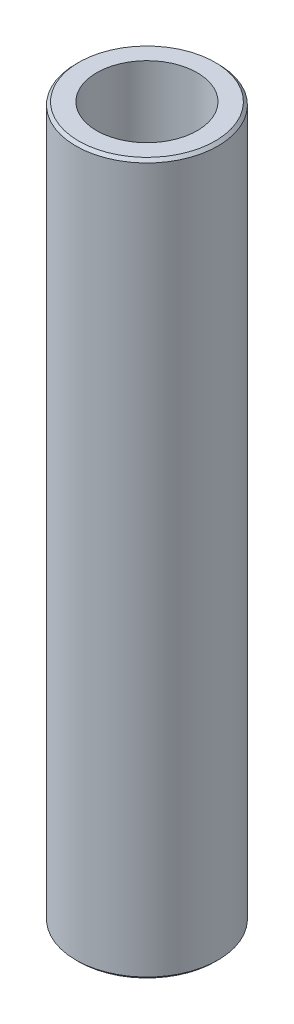
from build123d import *

# Parameters (mm, degrees)
SKETCH1_R           = 60
BOSS_EXTRUDE1_DEPTH = 600
SKETCH2_R           = 42.438677246
CUT_EXTRUDE1_DEPTH  = 606.970296302
CHAMFER1_SIZE       = 2.412618339


with BuildPart() as part:
    # Sketch1 → Boss-Extrude1 (new body)
    with BuildSketch(Plane(origin=(0, 0, 0), x_dir=(1, 0, 0), z_dir=(0, 1, 0))):
        Circle(SKETCH1_R)
    extrude(amount=BOSS_EXTRUDE1_DEPTH)

    # Sketch2 → Cut-Extrude1 (cut, through all)
    with BuildSketch(Plane(origin=(0, 0, 0), x_dir=(1, 0, 0), z_dir=(0, 1, 0))):
        Circle(SKETCH2_R)
    extrude(amount=CUT_EXTRUDE1_DEPTH, mode=Mode.SUBTRACT)

    # Chamfer1
    chamfer1_edges = [part.edges().sort_by_distance(p)[0] for p in [
        (-60, 600, 0),
        (-60, 0, 0),
    ]]
    chamfer(chamfer1_edges, length=CHAMFER1_SIZE)


solid = part.part
